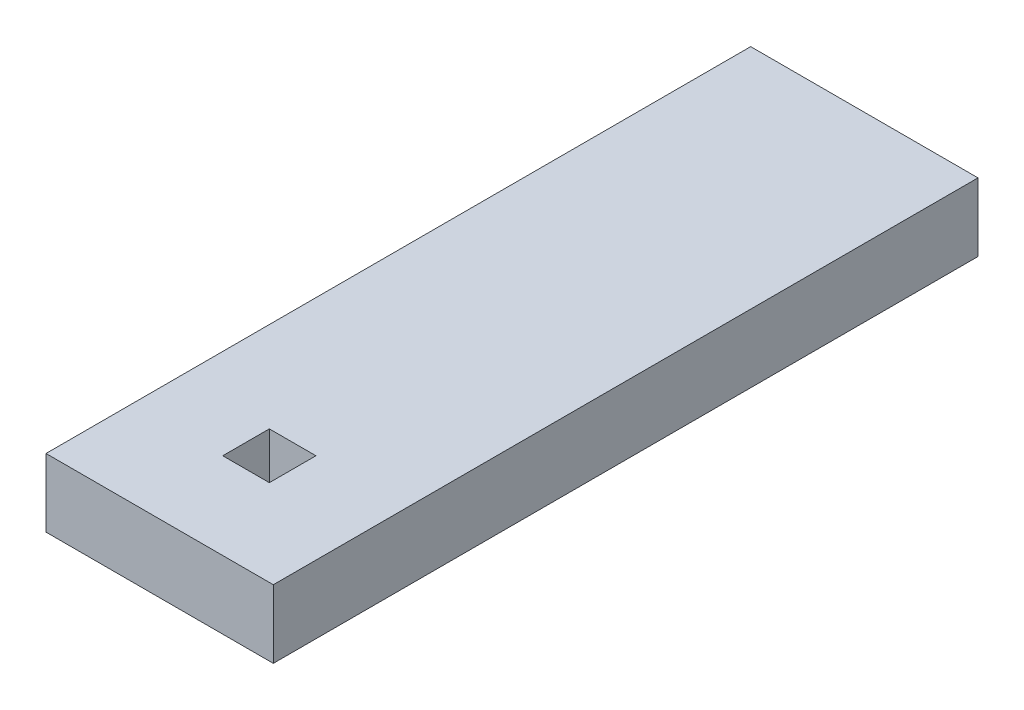
from build123d import *

# Parameters (mm, degrees)
SKETCH1_W           = 10
SKETCH1_H           = 31
SKETCH1_W_2         = 2.05
SKETCH1_H_2         = 2.05
BOSS_EXTRUDE1_DEPTH = 2.9972


with BuildPart() as part:
    # Sketch1 → Boss-Extrude1 (new body)
    with BuildSketch(Plane(origin=(0, 0, 0), x_dir=(1, 0, 0), z_dir=(0, 1, 0))):
        Rectangle(SKETCH1_W, SKETCH1_H)
        with Locations((0, -10.675)):
            Rectangle(SKETCH1_W_2, SKETCH1_H_2, mode=Mode.SUBTRACT)
    extrude(amount=BOSS_EXTRUDE1_DEPTH)


solid = part.part
